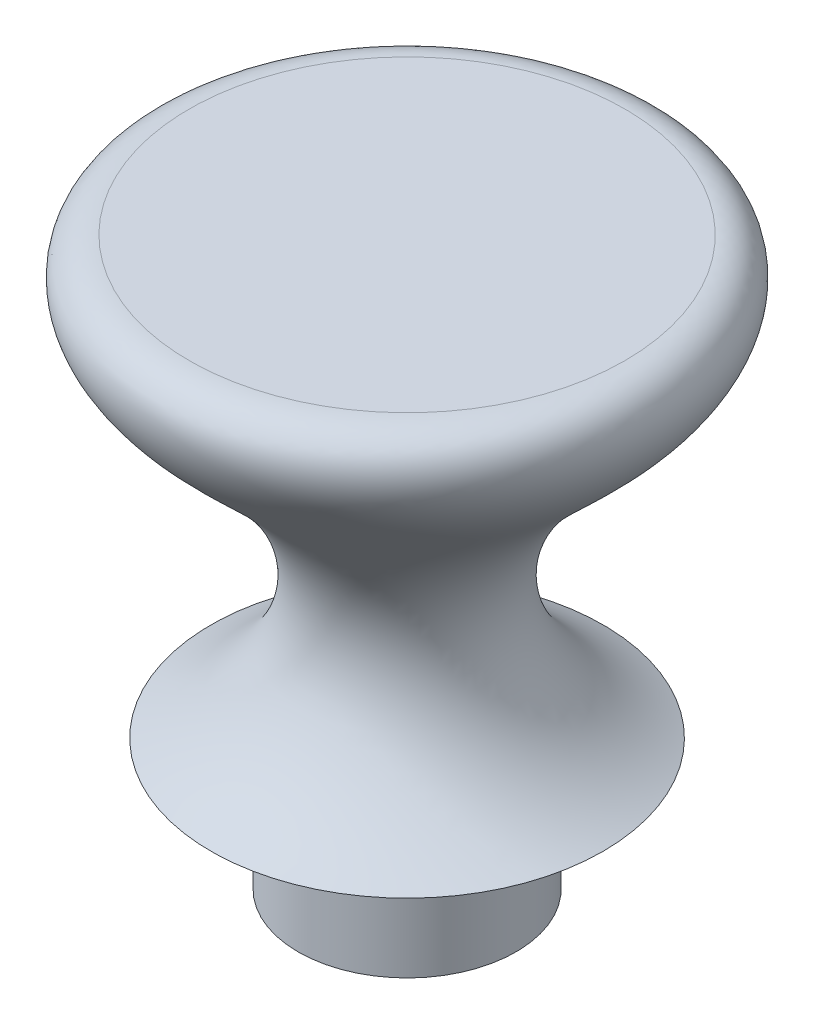
from build123d import *

# Parameters (mm, degrees)
ESBO_O2_R                = 2.5
RESSALTO_EXTRUS_O1_DEPTH = 3


# Read off the part's stored shape, not the designer's step: Revolução1
with BuildPart() as part:
    # Revolução1 outline → Revolução1 (revolve)
    with BuildSketch(Plane.XY):
        with BuildLine():
            Line((0, 10), (0, 0))
            Line((0, 0), (4.5, 0))
            add(Edge.make_bspline(
                [(4.5, 0), (0.623238461, 1.872834273), (0.988360922, 5.90505624), (4.195088629, 6.555926715), (6.465197847, 7.429045645), (6.576322074, 10), (5, 10)],
                knots=[0.434933168, 0.434933168, 0.434933168, 0.434933168, 0.434933168, 0.434933168, 0.434933168, 1.434933168, 1.434933168, 1.434933168, 1.434933168, 1.434933168, 1.434933168, 1.434933168], degree=6))
            Line((5, 10), (0, 10))
        make_face()
    revolve(axis=Axis((0, 0, 0), (0, 1, 0)))

    # Esboço2 → Ressalto-extrusão1 (add)
    with BuildSketch(Plane(origin=(0, 0, 0), x_dir=(1, 0, 0), z_dir=(0, 1, 0))):
        with Locations(Location((0, 0, 0), (0, 0, 270))):
            Circle(ESBO_O2_R)
    extrude(amount=-RESSALTO_EXTRUS_O1_DEPTH)


solid = part.part
